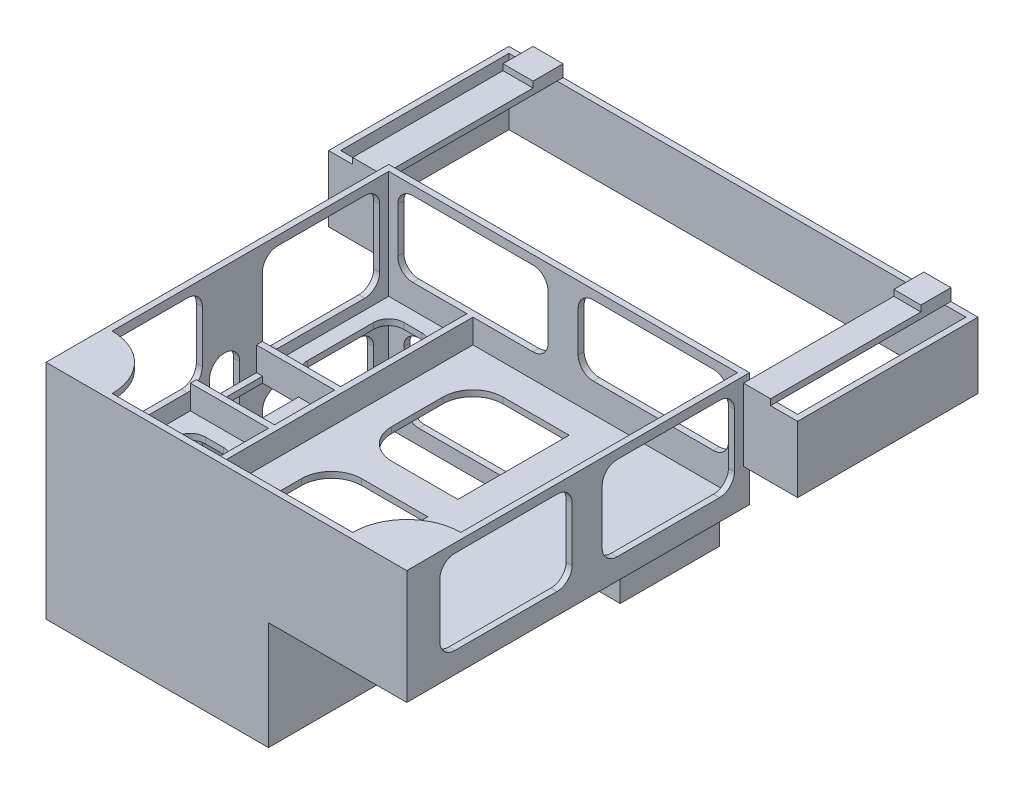
from build123d import *

# Parameters (mm, degrees)
SKETCH1_W                = 60
SKETCH1_H                = 54
BOSS_EXTRUDE1_DEPTH      = 38
SKETCH2_W                = 44
SKETCH2_H                = 52
CUT_EXTRUDE1_DEPTH       = 19
SKETCH3_W                = 35
SKETCH3_H                = 52
CUT_EXTRUDE2_DEPTH       = 18
SKETCH4_W                = 6
SKETCH4_H                = 10
CUT_EXTRUDE3_DEPTH       = 38
SKETCH5_W                = 14
SKETCH5_H                = 52
CUT_EXTRUDE5_DEPTH       = 15
SKETCH6_W                = 13
SKETCH6_H                = 52
CUT_EXTRUDE6_DEPTH       = 4
SKETCH8_W                = 14
SKETCH8_H                = 12.5
CUT_EXTRUDE7_DEPTH       = 6
SKETCH10_W               = 12.5
SKETCH10_H               = 5
CUT_EXTRUDE8_DEPTH       = 6
SKETCH11_W               = 4.5
SKETCH11_H               = 5
CUT_EXTRUDE9_DEPTH       = 18
SKETCH12_W               = 5
SKETCH12_H               = 17
CUT_EXTRUDE10_DEPTH      = 13
CUT_EXTRUDE11_DEPTH      = 1
SKETCH14_W               = 13
SKETCH14_H               = 1
BOSS_EXTRUDE2_DEPTH      = 4
SKETCH15_W               = 13
SKETCH15_H               = 1
BOSS_EXTRUDE3_DEPTH      = 4
CUT_EXTRUDE12_DEPTH      = 1
CUT_EXTRUDE13_DEPTH      = 1
CUT_EXTRUDE14_DEPTH      = 1
CUT_EXTRUDE15_DEPTH      = 60
CUT_EXTRUDE16_START      = -1
CUT_EXTRUDE16_DEPTH      = 1
CUT_EXTRUDE17_DEPTH      = 100
CUT_EXTRUDE17_DEPTH_BACK = 10
CUT_EXTRUDE18_DEPTH      = 10
SKETCH23_W               = 58
SKETCH23_H               = 52
BOSS_EXTRUDE4_DEPTH      = 1
SKETCH24_W               = 40
SKETCH24_H               = 10
SKETCH24_W_2             = 10
SKETCH24_H_2             = 34
CUT_EXTRUDE20_DEPTH      = 1
FILLET1_R                = 9
FILLET2_R                = 9
FILLET3_R                = 9
FILLET4_R                = 9
SKETCH27_W               = 10
SKETCH27_H               = 11
BOSS_EXTRUDE10_DEPTH     = 1
SKETCH31_W               = 1
SKETCH31_H               = 11
BOSS_EXTRUDE12_DEPTH     = 29
SKETCH33_W               = 1
SKETCH33_H               = 11
BOSS_EXTRUDE13_DEPTH     = 78
SKETCH34_W               = 5
SKETCH34_H               = 30
SKETCH34_W_2             = 4.5
BOSS_EXTRUDE14_DEPTH     = 1
SKETCH35_W               = 28
SKETCH35_H               = 11
BOSS_EXTRUDE15_DEPTH     = 1
SKETCH37_W               = 30
SKETCH37_H               = 11
CUT_EXTRUDE21_DEPTH      = 1
SKETCH38_W               = 28
SKETCH38_H               = 11
BOSS_EXTRUDE16_DEPTH     = 1
SKETCH39_W               = 30
SKETCH39_H               = 11
CUT_EXTRUDE22_DEPTH      = 1
SKETCH40_W               = 60
SKETCH40_H               = 37
BOSS_EXTRUDE17_DEPTH     = 3
SKETCH41_W               = 35
SKETCH41_H               = 18
CUT_EXTRUDE23_DEPTH      = 3
SKETCH42_W               = 44
SKETCH42_H               = 18
CUT_EXTRUDE24_DEPTH      = 3
SKETCH44_W               = 13
SKETCH44_H               = 18
CUT_EXTRUDE25_DEPTH      = 3
SKETCH45_W               = 3
SKETCH45_H               = 14
CUT_EXTRUDE26_DEPTH      = 3
SKETCH47_W               = 60
SKETCH47_H               = 10
CUT_EXTRUDE27_DEPTH      = 1
SKETCH48_W               = 60
SKETCH48_H               = 10
CUT_EXTRUDE28_DEPTH      = 1
SKETCH49_W               = 60
SKETCH49_H               = 10
BOSS_EXTRUDE18_DEPTH     = 1
SKETCH50_W               = 40
SKETCH50_H               = 9
CUT_EXTRUDE29_DEPTH      = 1
FILLET5_R                = 9
FILLET6_R                = 9
SKETCH51_W               = 5
SKETCH51_H               = 5
SKETCH51_W_2             = 4.5
BOSS_EXTRUDE19_DEPTH     = 1
SKETCH53_W               = 8
SKETCH53_H               = 9
CUT_EXTRUDE30_DEPTH      = 18
SKETCH54_W               = 2.5
SKETCH54_H               = 16.5
CUT_EXTRUDE31_DEPTH      = 18
SKETCH55_W               = 19.362337095
SKETCH55_H               = 47.149460103
BOSS_EXTRUDE20_DEPTH     = 1
SKETCH57_W               = 15
SKETCH57_H               = 9
CUT_EXTRUDE32_DEPTH      = 15
SKETCH58_W               = 6.289823119
SKETCH58_H               = 14.401479923
BOSS_EXTRUDE21_DEPTH     = 1
SKETCH59_W               = 15
SKETCH59_H               = 9
BOSS_EXTRUDE26_DEPTH     = 1
SKETCH60_W               = 4.5
SKETCH60_H               = 5
CUT_EXTRUDE33_DEPTH      = 1
SKETCH61_W               = 14
SKETCH61_H               = 12.5
CUT_EXTRUDE34_DEPTH      = 18
SKETCH62_W               = 12.5
SKETCH62_H               = 5
CUT_EXTRUDE35_DEPTH      = 18
SKETCH63_W               = 20.5
SKETCH63_H               = 16.5
CUT_EXTRUDE36_DEPTH      = 12
SKETCH64_W               = 13.575669256
SKETCH64_H               = 6.720460735
BOSS_EXTRUDE27_DEPTH     = 1


with BuildPart() as part:
    # Sketch1 → Boss-Extrude1 (new body)
    with BuildSketch(Plane(origin=(0, 0, 0), x_dir=(1, 0, 0), z_dir=(0, 1, 0))):
        with Locations((-83.874465942, -33.946435202)):
            Rectangle(SKETCH1_W, SKETCH1_H)
    extrude(amount=BOSS_EXTRUDE1_DEPTH)

    # Sketch2 → Cut-Extrude1 (cut)
    with BuildSketch(Plane(origin=(0, 38, 0), x_dir=(1, 0, 0), z_dir=(0, 1, 0))):
        with Locations((-76.874465942, -33.946435202)):
            Rectangle(SKETCH2_W, SKETCH2_H)
    extrude(amount=-CUT_EXTRUDE1_DEPTH, mode=Mode.SUBTRACT)

    # Sketch3 → Cut-Extrude2 (cut)
    with BuildSketch(Plane(origin=(0, 0, 0), x_dir=(-1, 0, 0), z_dir=(0, -1, 0))):
        with Locations((95.374465942, -33.946435202)):
            Rectangle(SKETCH3_W, SKETCH3_H)
    extrude(amount=-CUT_EXTRUDE2_DEPTH, mode=Mode.SUBTRACT)

    # Sketch4 → Cut-Extrude3 (cut)
    with BuildSketch(Plane(origin=(0, 18, 0), x_dir=(-1, 0, 0), z_dir=(0, -1, 0))):
        with Locations((108.874465942, -34.946435202)):
            Rectangle(SKETCH4_W, SKETCH4_H)
    extrude(amount=-CUT_EXTRUDE3_DEPTH, mode=Mode.SUBTRACT)

    # Sketch5 → Cut-Extrude5 (cut)
    with BuildSketch(Plane(origin=(0, 38, 0), x_dir=(1, 0, 0), z_dir=(0, 1, 0))):
        with Locations((-105.874465942, -33.946435202)):
            Rectangle(SKETCH5_W, SKETCH5_H)
    extrude(amount=-CUT_EXTRUDE5_DEPTH, mode=Mode.SUBTRACT)

    # Sketch6 → Cut-Extrude6 (cut)
    with BuildSketch(Plane(origin=(0, 23, 0), x_dir=(1, 0, 0), z_dir=(0, 1, 0))):
        with Locations((-106.374465942, -33.946435202)):
            Rectangle(SKETCH6_W, SKETCH6_H)
    extrude(amount=-CUT_EXTRUDE6_DEPTH, mode=Mode.SUBTRACT)

    # Sketch8 → Cut-Extrude7 (cut)
    with BuildSketch(Plane(origin=(0, 0, 0), x_dir=(-1, 0, 0), z_dir=(0, -1, 0))):
        with Locations((65.374465942, -17.696435202)):
            Rectangle(SKETCH8_W, SKETCH8_H)
    extrude(amount=-CUT_EXTRUDE7_DEPTH, mode=Mode.SUBTRACT)

    # Sketch10 → Cut-Extrude8 (cut)
    with BuildSketch(Plane(origin=(-72.374465942, 0, 0), x_dir=(0, 0, -1), z_dir=(1, 0, 0))):
        with Locations((-17.696435202, 3.5)):
            Rectangle(SKETCH10_W, SKETCH10_H)
    extrude(amount=-CUT_EXTRUDE8_DEPTH, mode=Mode.SUBTRACT)

    # Sketch11 → Cut-Extrude9 (cut)
    with BuildSketch(Plane.XZ):
        with Locations((-66.124465942, 48.446435202)):
            Rectangle(SKETCH11_W, SKETCH11_H)
    extrude(amount=-CUT_EXTRUDE9_DEPTH, mode=Mode.SUBTRACT)

    # Sketch12 → Cut-Extrude10 (cut)
    with BuildSketch(Plane(origin=(-68.374465942, 0, 0), x_dir=(0, 0, -1), z_dir=(1, 0, 0))):
        with Locations((-48.446435202, 9.5)):
            Rectangle(SKETCH12_W, SKETCH12_H)
    extrude(amount=-CUT_EXTRUDE10_DEPTH, mode=Mode.SUBTRACT)

    # Sketch13 → Cut-Extrude11 (cut)
    with BuildSketch(Plane.ZY.offset(113.874465942)):
        with BuildLine():
            Line((32.733045904, 15), (32.733045904, 22))
            ThreePointArc((32.733045904, 22), (35.233045904, 24.5), (37.733045904, 22))
            Line((37.733045904, 22), (37.733045904, 15))
            ThreePointArc((37.733045904, 15), (35.233045904, 12.5), (32.733045904, 15))
        make_face()
    extrude(amount=-CUT_EXTRUDE11_DEPTH, mode=Mode.SUBTRACT)

    # Sketch14 → Boss-Extrude2 (add)
    with BuildSketch(Plane(origin=(0, 19, 0), x_dir=(1, 0, 0), z_dir=(0, 1, 0))):
        with Locations((-106.374465942, -40.446435202)):
            Rectangle(SKETCH14_W, SKETCH14_H)
    extrude(amount=BOSS_EXTRUDE2_DEPTH)

    # Sketch15 → Boss-Extrude3 (add)
    with BuildSketch(Plane(origin=(0, 19, 0), x_dir=(1, 0, 0), z_dir=(0, 1, 0))):
        with Locations((-106.374465942, -29.446435202)):
            Rectangle(SKETCH15_W, SKETCH15_H)
    extrude(amount=BOSS_EXTRUDE3_DEPTH)

    # Sketch16 → Cut-Extrude12 (cut)
    with BuildSketch(Plane(origin=(0, 19, 0), x_dir=(1, 0, 0), z_dir=(0, 1, 0))):
        with BuildLine():
            Line((-64.874465942, -54.946435202), (-88.874465942, -54.946435202))
            ThreePointArc((-88.874465942, -54.946435202), (-92.409999848, -53.481969108), (-93.874465942, -49.946435202))
            Line((-93.874465942, -49.946435202), (-93.874465942, -41.446435202))
            ThreePointArc((-93.874465942, -41.446435202), (-92.409999848, -37.910901296), (-88.874465942, -36.446435202))
            Line((-88.874465942, -36.446435202), (-64.874465942, -36.446435202))
            ThreePointArc((-64.874465942, -36.446435202), (-61.338932037, -37.910901296), (-59.874465942, -41.446435202))
            Line((-59.874465942, -41.446435202), (-59.874465942, -49.946435202))
            ThreePointArc((-59.874465942, -49.946435202), (-61.338932037, -53.481969108), (-64.874465942, -54.946435202))
        make_face()
        with BuildLine():
            Line((-88.874465942, -31.446435202), (-64.874465942, -31.446435202))
            ThreePointArc((-64.874465942, -31.446435202), (-61.338932037, -29.981969108), (-59.874465942, -26.446435202))
            Line((-59.874465942, -26.446435202), (-59.874465942, -17.946435202))
            ThreePointArc((-59.874465942, -17.946435202), (-61.338932037, -14.410901296), (-64.874465942, -12.946435202))
            Line((-64.874465942, -12.946435202), (-88.874465942, -12.946435202))
            ThreePointArc((-88.874465942, -12.946435202), (-92.409999848, -14.410901296), (-93.874465942, -17.946435202))
            Line((-93.874465942, -17.946435202), (-93.874465942, -26.446435202))
            ThreePointArc((-93.874465942, -26.446435202), (-92.409999848, -29.981969108), (-88.874465942, -31.446435202))
        make_face()
    extrude(amount=-CUT_EXTRUDE12_DEPTH, mode=Mode.SUBTRACT)

    # Sketch17 → Cut-Extrude13 (cut)
    with BuildSketch(Plane(origin=(0, 19, 0), x_dir=(1, 0, 0), z_dir=(0, 1, 0))):
        with BuildLine():
            Line((-104.874465942, -57.446435202), (-107.874465942, -57.446435202))
            ThreePointArc((-107.874465942, -57.446435202), (-109.642232895, -56.714202155), (-110.374465942, -54.946435202))
            Line((-110.374465942, -54.946435202), (-110.374465942, -45.946435202))
            ThreePointArc((-110.374465942, -45.946435202), (-109.642232895, -44.178668249), (-107.874465942, -43.446435202))
            Line((-107.874465942, -43.446435202), (-104.874465942, -43.446435202))
            ThreePointArc((-104.874465942, -43.446435202), (-103.10669899, -44.178668249), (-102.374465942, -45.946435202))
            Line((-102.374465942, -45.946435202), (-102.374465942, -54.946435202))
            ThreePointArc((-102.374465942, -54.946435202), (-103.10669899, -56.714202155), (-104.874465942, -57.446435202))
        make_face()
        with BuildLine():
            Line((-104.874465942, -26.446435202), (-107.874465942, -26.446435202))
            ThreePointArc((-107.874465942, -26.446435202), (-109.642232895, -25.714202155), (-110.374465942, -23.946435202))
            Line((-110.374465942, -23.946435202), (-110.374465942, -12.946435202))
            ThreePointArc((-110.374465942, -12.946435202), (-109.642232895, -11.178668249), (-107.874465942, -10.446435202))
            Line((-107.874465942, -10.446435202), (-104.874465942, -10.446435202))
            ThreePointArc((-104.874465942, -10.446435202), (-103.10669899, -11.178668249), (-102.374465942, -12.946435202))
            Line((-102.374465942, -12.946435202), (-102.374465942, -23.946435202))
            ThreePointArc((-102.374465942, -23.946435202), (-103.10669899, -25.714202155), (-104.874465942, -26.446435202))
        make_face()
    extrude(amount=-CUT_EXTRUDE13_DEPTH, mode=Mode.SUBTRACT)

    # Sketch18 → Cut-Extrude14 (cut)
    with BuildSketch(Plane(origin=(-53.874465942, 0, 0), x_dir=(0, 0, -1), z_dir=(1, 0, 0))):
        with BuildLine():
            Line((-55.946435202, 35.5), (-38.946435202, 35.5))
            ThreePointArc((-38.946435202, 35.5), (-37.178668249, 34.767766953), (-36.446435202, 33))
            Line((-36.446435202, 33), (-36.446435202, 24))
            ThreePointArc((-36.446435202, 24), (-37.178668249, 22.232233047), (-38.946435202, 21.5))
            Line((-38.946435202, 21.5), (-55.946435202, 21.5))
            ThreePointArc((-55.946435202, 21.5), (-57.714202155, 22.232233047), (-58.446435202, 24))
            Line((-58.446435202, 24), (-58.446435202, 33))
            ThreePointArc((-58.446435202, 33), (-57.714202155, 34.767766953), (-55.946435202, 35.5))
        make_face()
        with BuildLine():
            Line((-28.946435202, 35.5), (-11.946435202, 35.5))
            ThreePointArc((-11.946435202, 35.5), (-10.178668249, 34.767766953), (-9.446435202, 33))
            Line((-9.446435202, 33), (-9.446435202, 24))
            ThreePointArc((-9.446435202, 24), (-10.178668249, 22.232233047), (-11.946435202, 21.5))
            Line((-11.946435202, 21.5), (-28.946435202, 21.5))
            ThreePointArc((-28.946435202, 21.5), (-30.714202155, 22.232233047), (-31.446435202, 24))
            Line((-31.446435202, 24), (-31.446435202, 33))
            ThreePointArc((-31.446435202, 33), (-30.714202155, 34.767766953), (-28.946435202, 35.5))
        make_face()
    extrude(amount=-CUT_EXTRUDE14_DEPTH, mode=Mode.SUBTRACT)

    # Sketch19 → Cut-Extrude15 (cut)
    with BuildSketch(Plane(origin=(0, 0, 6.946435202), x_dir=(-1, 0, 0), z_dir=(0, 0, -1))):
        with BuildLine():
            Line((58.874465942, 35.5), (78.874465942, 35.5))
            ThreePointArc((78.874465942, 35.5), (80.642232895, 34.767766953), (81.374465942, 33))
            Line((81.374465942, 33), (81.374465942, 26.304053451))
            ThreePointArc((81.374465942, 26.304053451), (80.642232895, 24.536286498), (78.874465942, 23.804053451))
            Line((78.874465942, 23.804053451), (58.874465942, 23.804053451))
            ThreePointArc((58.874465942, 23.804053451), (57.10669899, 24.536286498), (56.374465942, 26.304053451))
            Line((56.374465942, 26.304053451), (56.374465942, 33))
            ThreePointArc((56.374465942, 33), (57.10669899, 34.767766953), (58.874465942, 35.5))
        make_face()
        with BuildLine():
            Line((88.874465942, 35.5), (108.874465942, 35.5))
            ThreePointArc((108.874465942, 35.5), (110.642232895, 34.767766953), (111.374465942, 33))
            Line((111.374465942, 33), (111.374465942, 25.5))
            ThreePointArc((111.374465942, 25.5), (110.642232895, 23.732233047), (108.874465942, 23))
            Line((108.874465942, 23), (88.874465942, 23))
            ThreePointArc((88.874465942, 23), (87.10669899, 23.732233047), (86.374465942, 25.5))
            Line((86.374465942, 25.5), (86.374465942, 33))
            ThreePointArc((86.374465942, 33), (87.10669899, 34.767766953), (88.874465942, 35.5))
        make_face()
    extrude(amount=-CUT_EXTRUDE15_DEPTH, mode=Mode.SUBTRACT)

    # Sketch20 → Cut-Extrude16 (cut)
    with BuildSketch(Plane.ZY.offset(113.874465942).offset(CUT_EXTRUDE16_START)):
        with BuildLine():
            Line((11.946435202, 35.5), (26.446435202, 35.5))
            ThreePointArc((26.446435202, 35.5), (28.214202155, 34.767766953), (28.946435202, 33))
            Line((28.946435202, 33), (28.946435202, 23.221982389))
            ThreePointArc((28.946435202, 23.221982389), (28.214202155, 21.454215436), (26.446435202, 20.721982389))
            Line((26.446435202, 20.721982389), (11.946435202, 20.721982389))
            ThreePointArc((11.946435202, 20.721982389), (10.178668249, 21.454215436), (9.446435202, 23.221982389))
            Line((9.446435202, 23.221982389), (9.446435202, 33))
            ThreePointArc((9.446435202, 33), (10.178668249, 34.767766953), (11.946435202, 35.5))
        make_face()
        with BuildLine():
            Line((41.446435202, 35.5), (55.946435202, 35.5))
            ThreePointArc((55.946435202, 35.5), (57.714202155, 34.767766953), (58.446435202, 33))
            Line((58.446435202, 33), (58.446435202, 24.375603128))
            ThreePointArc((58.446435202, 24.375603128), (57.714202155, 22.607836175), (55.946435202, 21.875603128))
            Line((55.946435202, 21.875603128), (41.446435202, 21.875603128))
            ThreePointArc((41.446435202, 21.875603128), (39.678668249, 22.607836175), (38.946435202, 24.375603128))
            Line((38.946435202, 24.375603128), (38.946435202, 33))
            ThreePointArc((38.946435202, 33), (39.678668249, 34.767766953), (41.446435202, 35.5))
        make_face()
    extrude(amount=CUT_EXTRUDE16_DEPTH, mode=Mode.SUBTRACT)

    # Sketch21 → Cut-Extrude17 (cut, two sides: drawn at the far end of the back side and taken through both)
    with BuildSketch(Plane(origin=(0, 0, 59.946435202), x_dir=(-1, 0, 0), z_dir=(0, 0, -1)).offset(-CUT_EXTRUDE17_DEPTH_BACK)):
        with BuildLine():
            Line((107.874465942, 2.5), (82.874465942, 2.5))
            ThreePointArc((82.874465942, 2.5), (81.10669899, 3.232233047), (80.374465942, 5))
            Line((80.374465942, 5), (80.374465942, 13))
            ThreePointArc((80.374465942, 13), (81.10669899, 14.767766953), (82.874465942, 15.5))
            Line((82.874465942, 15.5), (107.874465942, 15.5))
            ThreePointArc((107.874465942, 15.5), (109.642232895, 14.767766953), (110.374465942, 13))
            Line((110.374465942, 13), (110.374465942, 5))
            ThreePointArc((110.374465942, 5), (109.642232895, 3.232233047), (107.874465942, 2.5))
        make_face()
    extrude(amount=CUT_EXTRUDE17_DEPTH + CUT_EXTRUDE17_DEPTH_BACK, mode=Mode.SUBTRACT)

    # Sketch22 → Cut-Extrude18 (cut)
    with BuildSketch(Plane(origin=(-112.874465942, 0, 0), x_dir=(0, 0, -1), z_dir=(1, 0, 0))):
        with BuildLine():
            Line((-12.946435202, 2.5), (-26.446435202, 2.5))
            ThreePointArc((-26.446435202, 2.5), (-28.214202155, 3.232233047), (-28.946435202, 5))
            Line((-28.946435202, 5), (-28.946435202, 13))
            ThreePointArc((-28.946435202, 13), (-28.214202155, 14.767766953), (-26.446435202, 15.5))
            Line((-26.446435202, 15.5), (-12.946435202, 15.5))
            ThreePointArc((-12.946435202, 15.5), (-11.178668249, 14.767766953), (-10.446435202, 13))
            Line((-10.446435202, 13), (-10.446435202, 5))
            ThreePointArc((-10.446435202, 5), (-11.178668249, 3.232233047), (-12.946435202, 2.5))
        make_face()
        with BuildLine():
            Line((-41.446435202, 2.5), (-54.946435202, 2.5))
            ThreePointArc((-54.946435202, 2.5), (-56.714202155, 3.232233047), (-57.446435202, 5))
            Line((-57.446435202, 5), (-57.446435202, 13))
            ThreePointArc((-57.446435202, 13), (-56.714202155, 14.767766953), (-54.946435202, 15.5))
            Line((-54.946435202, 15.5), (-41.446435202, 15.5))
            ThreePointArc((-41.446435202, 15.5), (-39.678668249, 14.767766953), (-38.946435202, 13))
            Line((-38.946435202, 13), (-38.946435202, 5))
            ThreePointArc((-38.946435202, 5), (-39.678668249, 3.232233047), (-41.446435202, 2.5))
        make_face()
    extrude(amount=-CUT_EXTRUDE18_DEPTH, mode=Mode.SUBTRACT)

    # Sketch23 → Boss-Extrude4 (add)
    with BuildSketch(Plane(origin=(0, 38, 0), x_dir=(1, 0, 0), z_dir=(0, 1, 0))):
        with Locations((-83.874465942, -33.946435202)):
            Rectangle(SKETCH23_W, SKETCH23_H)
    extrude(amount=-BOSS_EXTRUDE4_DEPTH)

    # Sketch24 → Cut-Extrude20 (cut)
    with BuildSketch(Plane(origin=(0, 38, 0), x_dir=(1, 0, 0), z_dir=(0, 1, 0))):
        with Locations((-83.874465942, -55.946435202)):
            Rectangle(SKETCH24_W, SKETCH24_H)
        with Locations((-58.874465942, -33.946435202)):
            Rectangle(SKETCH24_W_2, SKETCH24_H_2)
        with Locations((-83.874465942, -11.946435202)):
            Rectangle(SKETCH24_W, SKETCH24_H)
        with Locations((-83.874465942, -33.946435202)):
            Rectangle(SKETCH24_W, SKETCH24_H_2)
        with Locations((-108.874465942, -33.946435202)):
            Rectangle(SKETCH24_W_2, SKETCH24_H_2)
    extrude(amount=-CUT_EXTRUDE20_DEPTH, mode=Mode.SUBTRACT)

    # Fillet1
    fillet1_edges = [part.edges().sort_by_distance(p)[0] for p in [
        (-103.874465942, 37.5, 50.946435202),
    ]]
    fillet(fillet1_edges, radius=FILLET1_R)

    # Fillet2
    fillet2_edges = [part.edges().sort_by_distance(p)[0] for p in [
        (-63.874465942, 37.5, 16.946435202),
    ]]
    fillet(fillet2_edges, radius=FILLET2_R)

    # Fillet3
    fillet3_edges = [part.edges().sort_by_distance(p)[0] for p in [
        (-63.874465942, 37.5, 50.946435202),
    ]]
    fillet(fillet3_edges, radius=FILLET3_R)

    # Fillet4
    fillet4_edges = [part.edges().sort_by_distance(p)[0] for p in [
        (-103.874465942, 37.5, 16.946435202),
    ]]
    fillet(fillet4_edges, radius=FILLET4_R)

    # Sketch27 → Boss-Extrude10 (add)
    with BuildSketch(Plane(origin=(0, 0, 6.946435202), x_dir=(-1, 0, 0), z_dir=(0, 0, -1))):
        with Locations((48.874465942, 29.5)):
            Rectangle(SKETCH27_W, SKETCH27_H)
        with Locations((118.874465942, 29.5)):
            Rectangle(SKETCH27_W, SKETCH27_H)
    extrude(amount=-BOSS_EXTRUDE10_DEPTH)

    # Sketch31 → Boss-Extrude12 (add)
    with BuildSketch(Plane(origin=(0, 0, 6.946435202), x_dir=(-1, 0, 0), z_dir=(0, 0, -1))):
        with Locations((44.374465942, 29.5)):
            Rectangle(SKETCH31_W, SKETCH31_H)
        with Locations((123.374465942, 29.5)):
            Rectangle(SKETCH31_W, SKETCH31_H)
    extrude(amount=BOSS_EXTRUDE12_DEPTH)

    # Sketch33 → Boss-Extrude13 (add)
    with BuildSketch(Plane.ZY.offset(44.874465942)):
        with Locations((-21.553564798, 29.5)):
            Rectangle(SKETCH33_W, SKETCH33_H)
    extrude(amount=BOSS_EXTRUDE13_DEPTH)

    # Sketch34 → Boss-Extrude14 (add)
    with BuildSketch(Plane(origin=(0, 35, 0), x_dir=(1, 0, 0), z_dir=(0, 1, 0))):
        with Locations((-116.374465942, 7.053564798)):
            Rectangle(SKETCH34_W, SKETCH34_H)
        with Locations((-51.624465942, 7.053564798)):
            Rectangle(SKETCH34_W_2, SKETCH34_H)
    extrude(amount=BOSS_EXTRUDE14_DEPTH)

    # Sketch35 → Boss-Extrude15 (add)
    with BuildSketch(Plane(origin=(-122.874465942, 0, 0), x_dir=(0, 0, -1), z_dir=(1, 0, 0))):
        with Locations((7.053564798, 29.5)):
            Rectangle(SKETCH35_W, SKETCH35_H)
    extrude(amount=BOSS_EXTRUDE15_DEPTH)

    # Sketch37 → Cut-Extrude21 (cut)
    with BuildSketch(Plane.ZY.offset(123.874465942)):
        with Locations((-7.053564798, 29.5)):
            Rectangle(SKETCH37_W, SKETCH37_H)
    extrude(amount=-CUT_EXTRUDE21_DEPTH, mode=Mode.SUBTRACT)

    # Sketch38 → Boss-Extrude16 (add)
    with BuildSketch(Plane.ZY.offset(44.874465942)):
        with Locations((-7.053564798, 29.5)):
            Rectangle(SKETCH38_W, SKETCH38_H)
    extrude(amount=BOSS_EXTRUDE16_DEPTH)

    # Sketch39 → Cut-Extrude22 (cut)
    with BuildSketch(Plane(origin=(-43.874465942, 0, 0), x_dir=(0, 0, -1), z_dir=(1, 0, 0))):
        with Locations((7.053564798, 29.5)):
            Rectangle(SKETCH39_W, SKETCH39_H)
    extrude(amount=-CUT_EXTRUDE22_DEPTH, mode=Mode.SUBTRACT)

    # Sketch40 → Boss-Extrude17 (add)
    with BuildSketch(Plane.XY.offset(60.946435202)):
        with Locations((-83.874465942, 18.5)):
            Rectangle(SKETCH40_W, SKETCH40_H)
    extrude(amount=BOSS_EXTRUDE17_DEPTH)

    # Sketch41 → Cut-Extrude23 (cut)
    with BuildSketch(Plane(origin=(0, 0, 59.946435202), x_dir=(-1, 0, 0), z_dir=(0, 0, -1))):
        with Locations((95.374465942, 9)):
            Rectangle(SKETCH41_W, SKETCH41_H)
    extrude(amount=-CUT_EXTRUDE23_DEPTH, mode=Mode.SUBTRACT)

    # Sketch42 → Cut-Extrude24 (cut)
    with BuildSketch(Plane(origin=(0, 0, 59.946435202), x_dir=(-1, 0, 0), z_dir=(0, 0, -1))):
        with Locations((76.874465942, 28)):
            Rectangle(SKETCH42_W, SKETCH42_H)
    extrude(amount=-CUT_EXTRUDE24_DEPTH, mode=Mode.SUBTRACT)

    # Sketch44 → Cut-Extrude25 (cut)
    with BuildSketch(Plane(origin=(0, 0, 59.946435202), x_dir=(-1, 0, 0), z_dir=(0, 0, -1))):
        with Locations((106.374465942, 28)):
            Rectangle(SKETCH44_W, SKETCH44_H)
    extrude(amount=-CUT_EXTRUDE25_DEPTH, mode=Mode.SUBTRACT)

    # Sketch45 → Cut-Extrude26 (cut)
    with BuildSketch(Plane(origin=(-98.874465942, 0, 0), x_dir=(0, 0, -1), z_dir=(1, 0, 0))):
        with Locations((-61.446435202, 30)):
            Rectangle(SKETCH45_W, SKETCH45_H)
    extrude(amount=-CUT_EXTRUDE26_DEPTH, mode=Mode.SUBTRACT)

    # Sketch47 → Cut-Extrude27 (cut)
    with BuildSketch(Plane(origin=(0, 38, 0), x_dir=(1, 0, 0), z_dir=(0, 1, 0))):
        with Locations((-83.874465942, -11.946435202)):
            Rectangle(SKETCH47_W, SKETCH47_H)
    extrude(amount=-CUT_EXTRUDE27_DEPTH, mode=Mode.SUBTRACT)

    # Sketch48 → Cut-Extrude28 (cut)
    with BuildSketch(Plane(origin=(0, 38, 0), x_dir=(1, 0, 0), z_dir=(0, 1, 0))):
        with Locations((-83.874465942, -55.946435202)):
            Rectangle(SKETCH48_W, SKETCH48_H)
    extrude(amount=-CUT_EXTRUDE28_DEPTH, mode=Mode.SUBTRACT)

    # Sketch49 → Boss-Extrude18 (add)
    with BuildSketch(Plane(origin=(0, 37, 0), x_dir=(1, 0, 0), z_dir=(0, 1, 0))):
        with Locations((-83.874465942, -58.946435202)):
            Rectangle(SKETCH49_W, SKETCH49_H)
    extrude(amount=-BOSS_EXTRUDE18_DEPTH)

    # Sketch50 → Cut-Extrude29 (cut)
    with BuildSketch(Plane(origin=(0, 37, 0), x_dir=(1, 0, 0), z_dir=(0, 1, 0))):
        with Locations((-83.874465942, -58.446435202)):
            Rectangle(SKETCH50_W, SKETCH50_H)
    extrude(amount=-CUT_EXTRUDE29_DEPTH, mode=Mode.SUBTRACT)

    # Fillet5
    fillet5_edges = [part.edges().sort_by_distance(p)[0] for p in [
        (-103.874465942, 36.5, 53.946435202),
    ]]
    fillet(fillet5_edges, radius=FILLET5_R - 0.0001)  # a hair under: the kernel refuses the full size

    # Fillet6
    fillet6_edges = [part.edges().sort_by_distance(p)[0] for p in [
        (-63.874465942, 36.5, 53.946435202),
    ]]
    fillet(fillet6_edges, radius=FILLET6_R - 0.0001)  # a hair under: the kernel refuses the full size

    # Sketch51 → Boss-Extrude19 (add)
    with BuildSketch(Plane(origin=(0, 36, 0), x_dir=(1, 0, 0), z_dir=(0, 1, 0))):
        with Locations((-116.374465942, 19.553564798)):
            Rectangle(SKETCH51_W, SKETCH51_H)
        with Locations((-51.624465942, 19.553564798)):
            Rectangle(SKETCH51_W_2, SKETCH51_H)
    extrude(amount=BOSS_EXTRUDE19_DEPTH)

    # Sketch53 → Cut-Extrude30 (cut)
    with BuildSketch(Plane(origin=(0, 0, 0), x_dir=(-1, 0, 0), z_dir=(0, -1, 0))):
        Polygon((76.874465942, -34.339205591), (53.874465942, -34.339205591), (53.874465942, -43.946435202), (61.874465942, -43.946435202), (76.874465942, -43.946435202), align=None)
        with Locations((57.874465942, -48.446435202)):
            Rectangle(SKETCH53_W, SKETCH53_H)
        Polygon((61.874465942, -52.946435202), (53.874465942, -52.946435202), (53.874465942, -63.946435202), (76.874465942, -63.946435202), (76.874465942, -52.946435202), align=None)
    extrude(amount=-CUT_EXTRUDE30_DEPTH, mode=Mode.SUBTRACT)

    # Sketch54 → Cut-Extrude31 (cut)
    with BuildSketch(Plane(origin=(0, 0, 0), x_dir=(-1, 0, 0), z_dir=(0, -1, 0))):
        Polygon((53.874465942, -25.946435202), (53.874465942, -34.339205591), (76.874465942, -34.339205591), (76.874465942, -25.946435202), (56.374465942, -25.946435202), align=None)
        with Locations((55.124465942, -17.696435202)):
            Rectangle(SKETCH54_W, SKETCH54_H)
        Polygon((53.874465942, -6.946435202), (53.874465942, -9.446435202), (56.374465942, -9.446435202), (76.874465942, -9.446435202), (76.874465942, -6.946435202), align=None)
    extrude(amount=-CUT_EXTRUDE31_DEPTH, mode=Mode.SUBTRACT)

    # Sketch55 → Boss-Extrude20 (add)
    with BuildSketch(Plane(origin=(0, 19, 0), x_dir=(1, 0, 0), z_dir=(0, 1, 0))):
        with Locations((-68.193297395, -34.218039862)):
            Rectangle(SKETCH55_W, SKETCH55_H)
    extrude(amount=-BOSS_EXTRUDE20_DEPTH)

    # Sketch57 → Cut-Extrude32 (cut)
    with BuildSketch(Plane(origin=(0, 0, 0), x_dir=(-1, 0, 0), z_dir=(0, -1, 0))):
        with Locations((69.374465942, -48.446435202)):
            Rectangle(SKETCH57_W, SKETCH57_H)
    extrude(amount=-CUT_EXTRUDE32_DEPTH, mode=Mode.SUBTRACT)

    # Sketch58 → Boss-Extrude21 (add)
    with BuildSketch(Plane(origin=(-76.874465942, 0, 0), x_dir=(0, 0, -1), z_dir=(1, 0, 0))):
        with Locations((-48.091346762, 7.799260039)):
            Rectangle(SKETCH58_W, SKETCH58_H)
    extrude(amount=-BOSS_EXTRUDE21_DEPTH)

    # Sketch59 → Boss-Extrude26 (add)
    with BuildSketch(Plane(origin=(0, 15, 0), x_dir=(-1, 0, 0), z_dir=(0, -1, 0))):
        with Locations((69.374465942, -48.446435202)):
            Rectangle(SKETCH59_W, SKETCH59_H)
    extrude(amount=BOSS_EXTRUDE26_DEPTH)

    # Sketch60 → Cut-Extrude33 (cut)
    with BuildSketch(Plane(origin=(0, 14, 0), x_dir=(-1, 0, 0), z_dir=(0, -1, 0))):
        with Locations((66.124465942, -48.446435202)):
            Rectangle(SKETCH60_W, SKETCH60_H)
    extrude(amount=-CUT_EXTRUDE33_DEPTH, mode=Mode.SUBTRACT)

    # Sketch61 → Cut-Extrude34 (cut)
    with BuildSketch(Plane(origin=(0, 0, 0), x_dir=(-1, 0, 0), z_dir=(0, -1, 0))):
        with Locations((65.374465942, -17.696435202)):
            Rectangle(SKETCH61_W, SKETCH61_H)
    extrude(amount=-CUT_EXTRUDE34_DEPTH, mode=Mode.SUBTRACT)

    # Sketch62 → Cut-Extrude35 (cut)
    with BuildSketch(Plane.ZY.offset(77.874465942)):
        with Locations((17.696435202, 15.5)):
            Rectangle(SKETCH62_W, SKETCH62_H)
    extrude(amount=-CUT_EXTRUDE35_DEPTH, mode=Mode.SUBTRACT)

    # Sketch63 → Cut-Extrude36 (cut)
    with BuildSketch(Plane.XZ):
        with Locations((-66.624465942, 17.696435202)):
            Rectangle(SKETCH63_W, SKETCH63_H)
    extrude(amount=-CUT_EXTRUDE36_DEPTH, mode=Mode.SUBTRACT)

    # Sketch64 → Boss-Extrude27 (add)
    with BuildSketch(Plane(origin=(-76.874465942, 0, 0), x_dir=(0, 0, -1), z_dir=(1, 0, 0))):
        with Locations((-17.519703537, 4.074104241)):
            Rectangle(SKETCH64_W, SKETCH64_H)
    extrude(amount=-BOSS_EXTRUDE27_DEPTH)


solid = part.part
